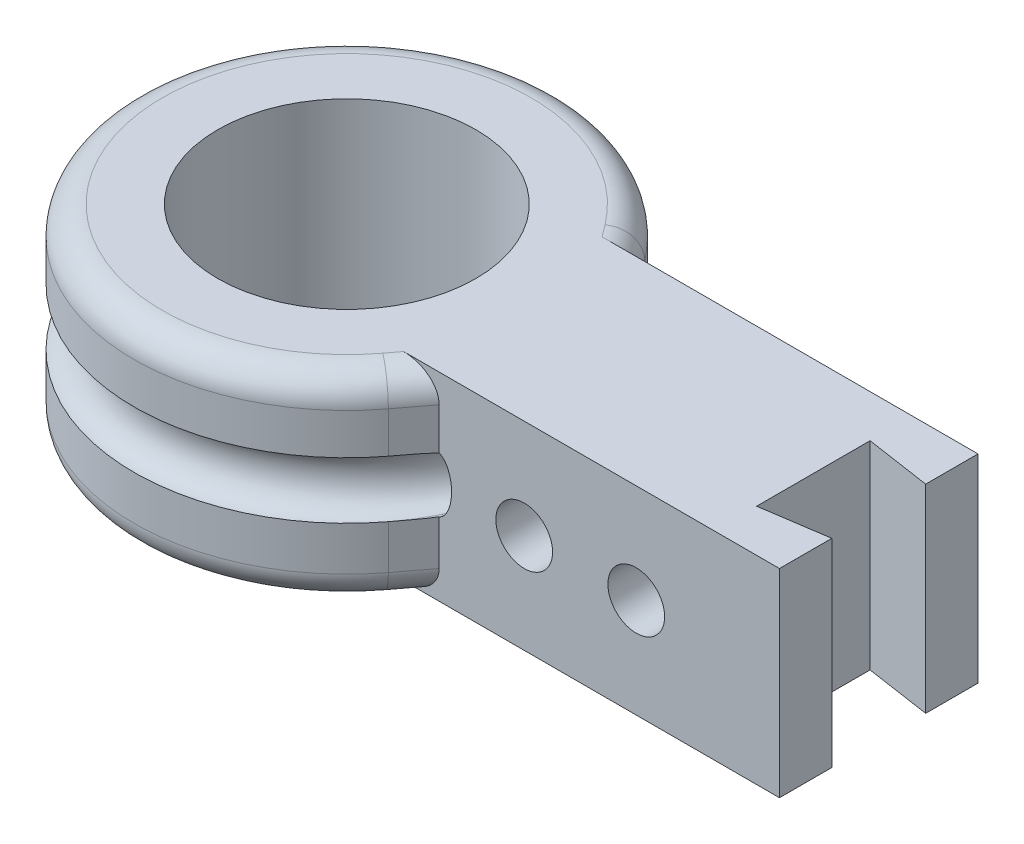
from build123d import *

# Parameters (mm, degrees)
SKETCH1_R           = 4.55
BOSS_EXTRUDE2_DEPTH = 7
CUT_EXTRUDE1_REACH  = 24.842
SKETCH3_R           = 1
FILLET4_R           = 1


with BuildPart() as part:
    # Sketch1 → Boss-Extrude2 (new body)
    with BuildSketch(Plane(origin=(0, 0, 0), x_dir=(1, 0, 0), z_dir=(0, 1, 0))):
        with BuildLine():
            Line((18.755630402, 3.5), (6.755630402, 3.5))
            Line((6.755630402, 3.5), (5.983960558, 4.521306895))
            ThreePointArc((5.983960558, 4.521306895), (-7.5, 0), (5.983960558, -4.521306895))
            Line((5.983960558, -4.521306895), (6.755630402, -3.5))
            Line((6.755630402, -3.5), (18.755630402, -3.5))
            Line((18.755630402, -3.5), (18.755630402, -1.655))
            Line((18.755630402, -1.655), (16.45, -2))
            Line((16.45, -2), (16.45, 2))
            Line((16.45, 2), (18.755630402, 1.655))
            Line((18.755630402, 1.655), (18.755630402, 3.5))
        make_face()
        Circle(SKETCH1_R, mode=Mode.SUBTRACT)
    extrude(amount=BOSS_EXTRUDE2_DEPTH)

    # Sketch2 → Cut-Revolve1 (revolve, cut)
    with BuildSketch(Plane(origin=(0, 0, 0), x_dir=(0, -1, 0), z_dir=(1, 0, 0))):
        with BuildLine():
            add(Edge.make_bspline(
                [(-4.555469281, 7.5), (-4.555469281, 6.7), (-3.555469281, 6.7), (-2.555469281, 6.7), (-2.555469281, 7.5)],
                knots=[3.141592654, 3.141592654, 3.141592654, 4.71238898, 4.71238898, 6.283185307, 6.283185307, 6.283185307], degree=2, weights=[1, 0.707106781, 1, 0.707106781, 1]))
            add(Edge.make_bspline(
                [(-2.555469281, 7.5), (-2.555469281, 8), (-3.555469281, 8), (-4.555469281, 8), (-4.555469281, 7.5)],
                knots=[0, 0, 0, 1.570796327, 1.570796327, 3.141592654, 3.141592654, 3.141592654], degree=2, weights=[1, 0.707106781, 1, 0.707106781, 1]))
        make_face()
    revolve(axis=Axis((0, 7.335318457, 0), (0, -1, 0)), mode=Mode.SUBTRACT)

    # Sketch3 → Cut-Extrude1 (cut, up to next)
    with BuildSketch(Plane.XY.offset(3.5), mode=Mode.PRIVATE) as cut_extrude1_sk1:
        with Locations((13.705630402, 3.5)):
            Circle(SKETCH3_R)
    cut_extrude1_tool1 = extrude(cut_extrude1_sk1.sketch, amount=-CUT_EXTRUDE1_REACH, mode=Mode.PRIVATE) & part.part
    # Sketch3 → Cut-Extrude1 (cut, up to next)
    with BuildSketch(Plane.XY.offset(3.5), mode=Mode.PRIVATE) as cut_extrude1_sk2:
        with Locations((9.755630402, 3.5)):
            Circle(SKETCH3_R)
    cut_extrude1_tool2 = extrude(cut_extrude1_sk2.sketch, amount=-CUT_EXTRUDE1_REACH, mode=Mode.PRIVATE) & part.part
    add(cut_extrude1_tool1.solids().sort_by_distance((13.70563, 3.5, 3.5))[0], mode=Mode.SUBTRACT)
    add(cut_extrude1_tool2.solids().sort_by_distance((9.75563, 3.5, 3.5))[0], mode=Mode.SUBTRACT)

    # Fillet4
    fillet4_edges = [part.edges().sort_by_distance(p)[0] for p in [
        (6.36979548, 0, -4.010653448),
        (6.36979548, 0, 4.010653448),
        (6.36979548, 7, -4.010653448),
        (6.36979548, 7, 4.010653448),
        (-7.5, 0, 0),
        (-7.5, 7, 0),
    ]]
    fillet(fillet4_edges, radius=FILLET4_R)


solid = part.part
